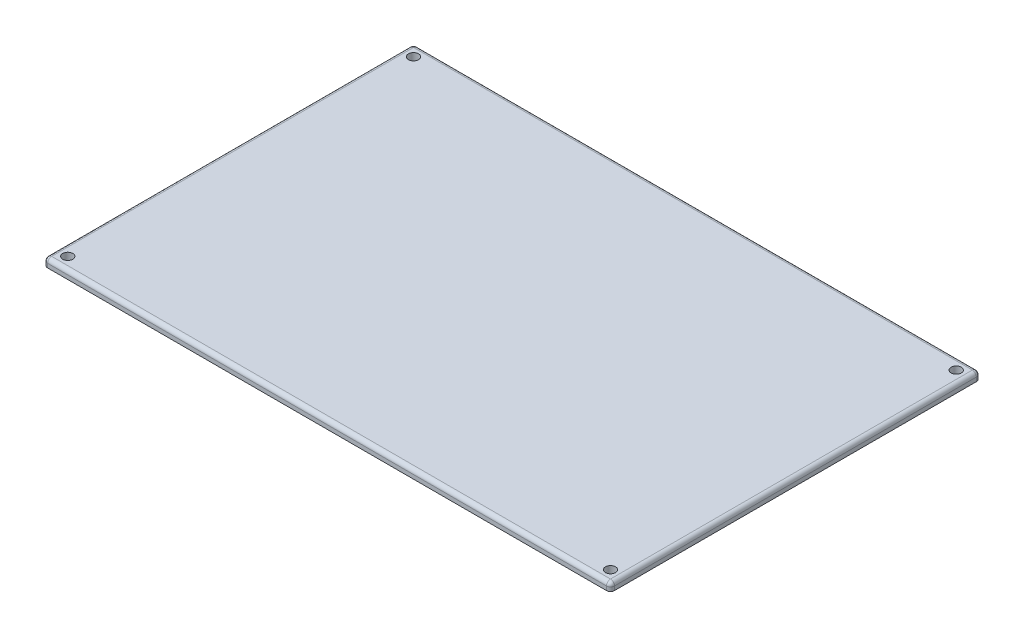
from build123d import *

# Parameters (mm, degrees)
SKETCH1_W           = 141
SKETCH1_H           = 92
BOSS_EXTRUDE1_DEPTH = 2
SKETCH2_R           = 1.26
CUT_EXTRUDE1_DEPTH  = 10
FILLET1_R           = 1
SHELL1_T            = -1.5
FILLET2_R           = 1


with BuildPart() as part:
    # Sketch1 → Boss-Extrude1 (new body)
    with BuildSketch(Plane(origin=(0, 0, 0), x_dir=(1, 0, 0), z_dir=(0, 1, 0))):
        with Locations((70.5, 46)):
            Rectangle(SKETCH1_W, SKETCH1_H)
    extrude(amount=BOSS_EXTRUDE1_DEPTH)

    # Sketch2 → Cut-Extrude1 (cut)
    with BuildSketch(Plane.XZ):
        with Locations(Location((3, -3, 0), (0, 0, 270))):
            Circle(SKETCH2_R)
        with Locations(Location((138, -3, 0), (0, 0, 270))):
            Circle(SKETCH2_R)
        with Locations(Location((138, -89, 0), (0, 0, 270))):
            Circle(SKETCH2_R)
        with Locations(Location((3, -89, 0), (0, 0, 270))):
            Circle(SKETCH2_R)
    extrude(amount=-CUT_EXTRUDE1_DEPTH, mode=Mode.SUBTRACT)

    # Fillet1
    fillet1_edges = [part.edges().sort_by_distance(p)[0] for p in [
        (141, 2, -46),
        (70.5, 2, -92),
        (0, 2, -46),
        (70.5, 2, 0),
    ]]
    fillet(fillet1_edges, radius=FILLET1_R)

    # Shell1
    shell1_openings = [part.faces().sort_by_distance(p)[0] for p in [
        (70.5, 0, -46),
    ]]
    offset(amount=SHELL1_T, openings=shell1_openings, kind=Kind.INTERSECTION)

    # Fillet2
    # the kernel refuses this fillet: 1 mm, written as the material it takes off along each edge
    with BuildSketch(Plane(origin=(1, 1, -1), x_dir=(-1, 0, 0), z_dir=(0, 0, 1))) as fillet2_piece_1_section:
        Polygon((0, 0), (FILLET2_R, 0), (FILLET2_R, -FILLET2_R), (0, -FILLET2_R), align=None)
    fillet2_piece_1 = extrude(amount=FILLET2_R, mode=Mode.PRIVATE)
    fillet2_piece_1 = fillet2_piece_1 - Plane(origin=(1, 1, -1), x_dir=(0.7071067811865475, -0.7071067811865475, 0), z_dir=(0, 0, 1)) * Sphere(FILLET2_R, mode=Mode.PRIVATE)
    add(fillet2_piece_1, mode=Mode.SUBTRACT)
    with BuildSketch(Plane(origin=(1, 1, -91), x_dir=(-1, 0, 0), z_dir=(0, 0, -1))) as fillet2_piece_2_section:
        Polygon((0, 0), (FILLET2_R, 0), (FILLET2_R, FILLET2_R), (0, FILLET2_R), align=None)
    fillet2_piece_2 = extrude(amount=FILLET2_R, mode=Mode.PRIVATE)
    fillet2_piece_2 = fillet2_piece_2 - Plane(origin=(1, 1, -91), x_dir=(0.7071067811865475, -0.7071067811865475, 0), z_dir=(0, 0, -1)) * Sphere(FILLET2_R, mode=Mode.PRIVATE)
    add(fillet2_piece_2, mode=Mode.SUBTRACT)
    with BuildSketch(Plane(origin=(140, 1, -1), x_dir=(1, 0, 0), z_dir=(0, 0, 1))) as fillet2_piece_3_section:
        Polygon((0, 0), (FILLET2_R, 0), (FILLET2_R, FILLET2_R), (0, FILLET2_R), align=None)
    fillet2_piece_3 = extrude(amount=FILLET2_R, mode=Mode.PRIVATE)
    fillet2_piece_3 = fillet2_piece_3 - Plane(origin=(140, 1, -1), x_dir=(-0.7071067811865475, -0.7071067811865475, 0), z_dir=(0, 0, 1)) * Sphere(FILLET2_R, mode=Mode.PRIVATE)
    add(fillet2_piece_3, mode=Mode.SUBTRACT)
    with BuildSketch(Plane(origin=(140, 1, -91), x_dir=(0, 0, -1), z_dir=(1, 0, 0))) as fillet2_piece_4_section:
        Polygon((0, 0), (FILLET2_R, 0), (FILLET2_R, FILLET2_R), (0, FILLET2_R), align=None)
    fillet2_piece_4 = extrude(amount=FILLET2_R, mode=Mode.PRIVATE)
    fillet2_piece_4 = fillet2_piece_4 - Plane(origin=(140, 1, -91), x_dir=(0, -0.7071067811865475, 0.7071067811865475), z_dir=(1, 0, 0)) * Sphere(FILLET2_R, mode=Mode.PRIVATE)
    add(fillet2_piece_4, mode=Mode.SUBTRACT)
    with BuildSketch(Plane(origin=(141, -2.5, -92), x_dir=(0, 0, 1), z_dir=(0, 1, 0)), Plane(origin=(141, -2.5, 0), x_dir=(-1, 0, 0), z_dir=(0, 1, 0)), Plane(origin=(0, -2.5, -92), x_dir=(1, 0, 0), z_dir=(0, 1, 0))) as fillet2_piece_5:
        with BuildLine():
            CenterArc((FILLET2_R, -FILLET2_R), FILLET2_R, 90, 90)
            Line((0, -FILLET2_R), (0, 0))
            Line((0, 0), (FILLET2_R, 0))
        make_face()
    extrude(amount=3.5, mode=Mode.SUBTRACT)
    with BuildSketch(Plane(origin=(0, -2.5, 0), x_dir=(1, 0, 0), z_dir=(0, 1, 0))) as fillet2_piece_6:
        with BuildLine():
            CenterArc((FILLET2_R, FILLET2_R), FILLET2_R, 180, 90)
            Line((0, FILLET2_R), (0, 0))
            Line((0, 0), (FILLET2_R, 0))
        make_face()
    extrude(amount=3.5, mode=Mode.SUBTRACT)


solid = part.part
